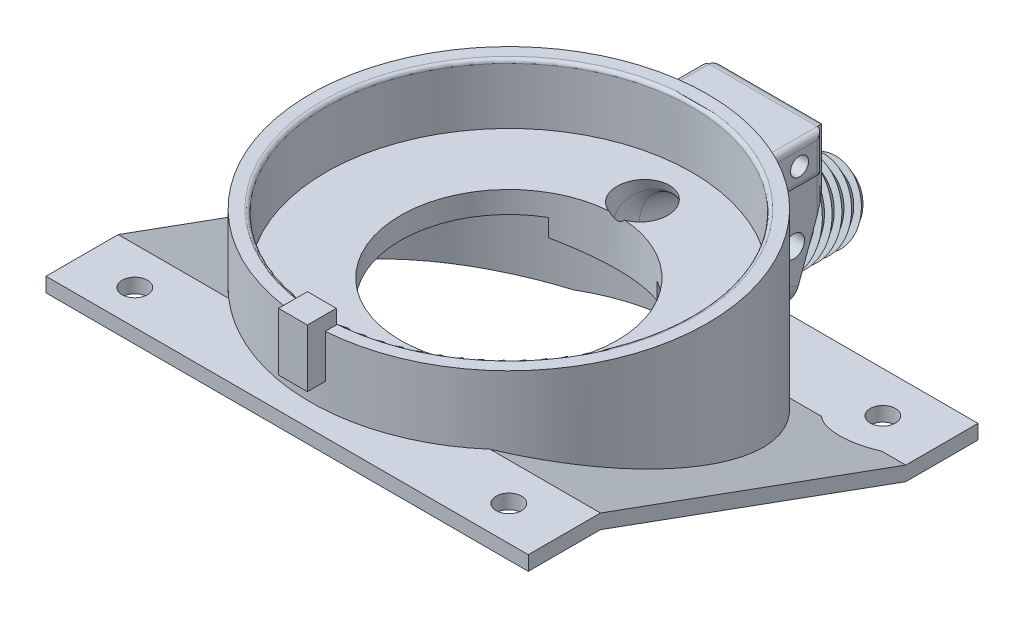
from build123d import *

# Parameters (mm, degrees)
SKETCH1_W                 = 56.8
SKETCH1_H                 = 56.8
BOSS_EXTRUDE1_DEPTH       = 5
SKETCH1_4_R               = 19.175
CUT_EXTRUDE1_DEPTH        = 1.65
SKETCH3_R                 = 15
CUT_EXTRUDE2_DEPTH        = 3.35
BOSS_EXTRUDE2_START       = 25.04
SKETCH3_3_R               = 27.5
SKETCH3_3_R_2             = 15
BOSS_EXTRUDE2_DEPTH       = 25.04
BOSS_EXTRUDE3_START       = 8.3
SKETCH4_R                 = 27.5
SKETCH4_R_2               = 25.35
BOSS_EXTRUDE3_DEPTH       = 8.3
BOSS_EXTRUDE9_DEPTH       = 1.5
BOSS_EXTRUDE9_DEPTH_BACK  = 2.5
SKETCH14_W                = 4
SKETCH14_H                = 8
FILLET3_R                 = 0.5
BOSS_EXTRUDE11_REACH      = 79.747
BOSS_EXTRUDE11_END_RADIUS = 27.5
SKETCH20_W                = 15
SKETCH20_H                = 15
FILLET6_R                 = 3
FILLET7_R                 = 3
SKETCH16_R                = 3.5
BOSS_EXTRUDE12_REACH      = 70.482
SKETCH31_W                = 15
SKETCH31_H                = 11.019981461
CUT_EXTRUDE3_REACH        = 84.891
CUT_EXTRUDE3_END_RADIUS   = 27.5
SKETCH33_W                = 15
SKETCH33_H                = 4
SKETCH29_R                = 1.5
SKETCH29_R_2              = 1.25
CUT_EXTRUDE4_DEPTH        = 74.003133429
FILLET8_R                 = 1.5
SKETCH35_W                = 18.713007332
SKETCH35_H                = 12.610559202
CUT_EXTRUDE5_DEPTH        = 10
SKETCH43_W                = 21.654052674
SKETCH43_H                = 15.753045928
CUT_EXTRUDE6_DEPTH        = 1.4
SKETCH44_W                = 56.8
SKETCH44_H                = 56.8
CUT_EXTRUDE8_DEPTH        = 13.5
BOSS_EXTRUDE14_DEPTH      = 66.8
BOSS_EXTRUDE15_REACH      = 56.298
SKETCH48_W                = 9
SKETCH48_H                = 4.737692211
SKETCH50_W                = 66.8
SKETCH50_H                = 45
CUT_EXTRUDE9_DEPTH        = 66.8
SKETCH51_W                = 66.8
SKETCH51_H                = 10
CUT_EXTRUDE10_DEPTH       = 66.8
SKETCH52_R                = 15
CUT_EXTRUDE11_DEPTH       = 66.8
CUT_EXTRUDE12_DEPTH       = 15.54
CUT_EXTRUDE13_DEPTH       = 70.889562662
CUT_EXTRUDE13_DEPTH_BACK  = 70.889562662
SKETCH54_R                = 1.75
SKETCH55_R                = 6
CUT_EXTRUDE14_DEPTH       = 10
SKETCH56_W                = 8.754083382
SKETCH56_H                = 5.505064768
BOSS_EXTRUDE16_DEPTH      = 0.8
SKETCH57_W                = 8.754083382
SKETCH57_H                = 5.505064768
BOSS_EXTRUDE17_DEPTH      = 0.8
CUT_EXTRUDE15_DEPTH       = 75.215099333
CUT_EXTRUDE15_DEPTH_BACK  = 75.215099333
SKETCH58_R                = 1.25
FILLET10_R                = 0.8
SKETCH59_R                = 25
CUT_EXTRUDE16_DEPTH       = 7.5
CUT_EXTRUDE17_DEPTH       = 15
BOSS_EXTRUDE18_REACH      = 73.887
BOSS_EXTRUDE18_END_RADIUS = 3.5
SKETCH64_R                = 1.5
SKETCH64_R_2              = 0.55
BOSS_EXTRUDE19_REACH      = 73.887
SKETCH65_R                = 1.5
SKETCH65_R_2              = 0.55
SKETCH67_R                = 3.5
CUT_EXTRUDE18_DEPTH       = 20


with BuildPart() as part:
    # Sketch1 → Boss-Extrude1 (new body)
    with BuildSketch(Plane(origin=(0, 0, 0), x_dir=(1, 0, 0), z_dir=(0, 1, 0))):
        Rectangle(SKETCH1_W, SKETCH1_H)
    extrude(amount=BOSS_EXTRUDE1_DEPTH)

    # Sketch1<4> → Cut-Extrude1 (cut)
    with BuildSketch(Plane(origin=(0, 0, 0), x_dir=(1, 0, 0), z_dir=(0, 1, 0))):
        with Locations(Location((0, 0, 0), (0, 0, 270))):
            Circle(SKETCH1_4_R)
    extrude(amount=CUT_EXTRUDE1_DEPTH, mode=Mode.SUBTRACT)

    # Sketch3 → Cut-Extrude2 (cut)
    with BuildSketch(Plane(origin=(0, 5, 0), x_dir=(1, 0, 0), z_dir=(0, 1, 0))):
        with Locations(Location((0, 0, 0), (0, 0, 270))):
            Circle(SKETCH3_R)
    extrude(amount=-CUT_EXTRUDE2_DEPTH, mode=Mode.SUBTRACT)

    # Sketch3<3> → Boss-Extrude2 (add)
    with BuildSketch(Plane(origin=(0, 5, 0), x_dir=(1, 0, 0), z_dir=(0, 1, 0)).offset(BOSS_EXTRUDE2_START)):
        with Locations(Location((0, 0, 0), (0, 0, 90))):
            Circle(SKETCH3_3_R)
        with Locations(Location((0, 0, 0), (0, 0, 270))):
            Circle(SKETCH3_3_R_2, mode=Mode.SUBTRACT)
    extrude(amount=-BOSS_EXTRUDE2_DEPTH)

    # Sketch4 → Boss-Extrude3 (add)
    with BuildSketch(Plane(origin=(0, 30.04, 0), x_dir=(1, 0, 0), z_dir=(0, 1, 0)).offset(BOSS_EXTRUDE3_START)):
        with Locations(Location((0, 0, 0), (0, 0, 90))):
            Circle(SKETCH4_R)
        with Locations(Location((0, 0, 0), (0, 0, 90))):
            Circle(SKETCH4_R_2, mode=Mode.SUBTRACT)
    extrude(amount=-BOSS_EXTRUDE3_DEPTH)

    # Sketch14 → Boss-Extrude9 (add, two sides: drawn at the far end of the back side and taken through both)
    with BuildSketch(Plane.XY.offset(28.4).offset(-BOSS_EXTRUDE9_DEPTH_BACK)):
        with Locations((0, 36.34)):
            Rectangle(SKETCH14_W, SKETCH14_H)
    extrude(amount=BOSS_EXTRUDE9_DEPTH + BOSS_EXTRUDE9_DEPTH_BACK)

    # Fillet3
    fillet3_edges = [part.edges().sort_by_distance(p)[0] for p in [
        (0, 38.34, 25.35),
    ]]
    fillet(fillet3_edges, radius=FILLET3_R)

    # Boss-Extrude11: up to this cylinder (the profile starts outside it)
    boss_extrude11_end = Plane(origin=(0, 20.788229, 0), z_dir=(0, -1, 0)) * Cylinder(BOSS_EXTRUDE11_END_RADIUS, 215.494, mode=Mode.PRIVATE)
    # Sketch20 → Boss-Extrude11 (add, up to the surface)
    with BuildSketch(Plane(origin=(0, -8.542695165, -23.470862068), x_dir=(1, 0, 0), z_dir=(0, -0.34202014332567265, -0.939692620785907)), mode=Mode.PRIVATE) as boss_extrude11_sk1:
        with Locations((0, -31.213317572)):
            Rectangle(SKETCH20_W, SKETCH20_H)
    boss_extrude11_tool1 = extrude(boss_extrude11_sk1.sketch, amount=-BOSS_EXTRUDE11_REACH, mode=Mode.PRIVATE) - boss_extrude11_end
    add(boss_extrude11_tool1.solids().sort_by_distance((0, 20.788229, -34.146445))[0])

    # Fillet6
    fillet6_edges = [part.edges().sort_by_distance(p)[0] for p in [
        (-7.5, 14.672986299, -29.019403727),
    ]]
    fillet(fillet6_edges, radius=FILLET6_R)

    # Fillet7
    fillet7_edges = [part.edges().sort_by_distance(p)[0] for p in [
        (7.5, 14.672986299, -29.019403727),
    ]]
    fillet(fillet7_edges, radius=FILLET7_R)

    # Sketch26 → Revolve4 (revolve)
    with BuildSketch(Plane(origin=(0, 29.330924193, -10.67558335), x_dir=(-1, 0, 0), z_dir=(0, -0.939692620785907, 0.34202014332567265)), mode=Mode.PRIVATE) as revolve4_sk:
        Polygon((0, 24.977169714), (7.5, 24.977169714), (6, 26.977169714), (7, 26.977169714), (5.5, 28.977169714), (6.5, 28.977169714), (5, 30.977169714), (6, 30.977169714), (4.5, 32.977169714), (5.5, 32.977169714), (4, 34.977169714), (5, 34.977169714), (3.5, 36.977169714), (4.5, 36.977169714), (3, 38.977169714), (4, 38.977169714), (2.5, 40.977169714), (3.5, 40.977169714), (2, 42.977169714), (3, 42.977169714), (1.5, 44.977169714), (2.5, 44.977169714), (1, 46.977169714), (2, 46.977169714), (0.5, 48.977169714), (1.5, 48.977169714), (0, 50.977169714), align=None)
    revolve(revolve4_sk.sketch.rotate(Axis((0, 25.301255695, -21.747006554), (0, -0.34202014332567277, -0.939692620785907)), 270), axis=Axis((0, 25.301255695, -21.747006554), (0, -0.34202014332567277, -0.939692620785907)))

    # Cut-Sweep3: sweep along a path in Sketch15
    with BuildLine(Plane(origin=(0, 0, 0), x_dir=(0, 0, -1), z_dir=(1, 0, 0))) as cut_sweep3_path:
        Line((17.740868921, 32.130351748), (19.356316645, 27.691945605))
        ThreePointArc((19.356316645, 27.691945605), (20.286660003, 26.231599054), (21.747006554, 25.301255695))
        Line((21.747006554, 25.301255695), (58.776383407, 11.823664728))
    # Sketch16 → Cut-Sweep3 (sweep, cut)
    with BuildSketch(Plane(origin=(0, 32.130351748, -17.740868921), x_dir=(-1, 0, 0), z_dir=(0, -0.9396926207859093, -0.3420201433256665))):
        Circle(SKETCH16_R)
    sweep(path=cut_sweep3_path.line, mode=Mode.SUBTRACT)


with BuildPart() as cut_sweep3_piece_1:
    # of the separate pieces the step leaves, piece 1, a body of its own (cut_sweep3_pieces)
    add(part.part.solids().sort_by_distance((4.5, 15.360920541, -27.129319933))[0])

    # Boss-Extrude12: up to this face of the body (flat: up to its plane)
    boss_extrude12_end = Plane(cut_sweep3_piece_1.part.faces().sort_by_distance((0, 29.576878134, -31.928363452))[0])
    # Sketch31 → Boss-Extrude12 (add, up to the picked face)
    with BuildSketch(Plane(origin=(0, 38.34, 0), x_dir=(1, 0, 0), z_dir=(0, 1, 0)), mode=Mode.PRIVATE) as boss_extrude12_sk1:
        with Locations((0, 31.201605763)):
            Rectangle(SKETCH31_W, SKETCH31_H)
    boss_extrude12_tool1 = split(extrude(boss_extrude12_sk1.sketch, amount=-BOSS_EXTRUDE12_REACH, mode=Mode.PRIVATE), bisect_by=boss_extrude12_end, keep=Keep.BOTH, mode=Mode.PRIVATE)
    add(boss_extrude12_tool1.solids().sort_by(Axis((0, 38.34, -31.201606), (0, -1, 0)))[0])

    # Cut-Extrude3: up to this cylinder (the profile starts outside it)
    cut_extrude3_end = Plane(origin=(0, 36.34, 0), z_dir=(0, -1, 0)) * Cylinder(CUT_EXTRUDE3_END_RADIUS, 225.782, mode=Mode.PRIVATE)
    # Sketch33 → Cut-Extrude3 (cut, up to the surface)
    with BuildSketch(Plane(origin=(0, 0, -36.711596493), x_dir=(-1, 0, 0), z_dir=(0, 0, -1)), mode=Mode.PRIVATE) as cut_extrude3_sk1:
        with Locations((0, 36.34)):
            Rectangle(SKETCH33_W, SKETCH33_H)
    cut_extrude3_tool1 = extrude(cut_extrude3_sk1.sketch, amount=-CUT_EXTRUDE3_REACH, mode=Mode.PRIVATE) - cut_extrude3_end
    add(cut_extrude3_tool1.solids().sort_by_distance((0, 36.34, -36.711596))[0], mode=Mode.SUBTRACT)

    # Sketch29 → Cut-Extrude4 (cut, through all)
    with BuildSketch(Plane.ZY.offset(7.5)):
        with Locations((-31.957513111, 21.584935232)):
            Circle(SKETCH29_R)
        with Locations((-31.957513111, 31.584935232)):
            Circle(SKETCH29_R_2)
    extrude(amount=-CUT_EXTRUDE4_DEPTH, mode=Mode.SUBTRACT)

    # Fillet8
    fillet8_edges = [cut_sweep3_piece_1.edges().sort_by_distance(p)[0] for p in [
        (7.5, 31.087961842, -36.711596493),
        (-7.5, 31.087961842, -36.711596493),
        (0, 34.34, -36.711596493),
    ]]
    fillet(fillet8_edges, radius=FILLET8_R)


with BuildPart() as cut_sweep3_piece_2:
    # of the separate pieces the step leaves, piece 2, a body of its own (cut_sweep3_pieces)
    add(part.part.solids().sort_by_distance((0, 12.455370514, -43.883666222))[0])


with BuildPart() as cut_sweep3_piece_3:
    # of the separate pieces the step leaves, piece 3, a body of its own (cut_sweep3_pieces)
    add(part.part.solids().sort_by_distance((0, 12.241176538, -45.934061536))[0])


with BuildPart() as cut_extrude5_tool:
    # Sketch35 → Cut-Extrude5 (new body)
    with BuildSketch(Plane(origin=(0, -12.954755014, -35.592896876), x_dir=(1, 0, 0), z_dir=(0, 0.3420201433256728, 0.939692620785907))):
        with Locations((0.331511876, 30.668843549)):
            Rectangle(SKETCH35_W, SKETCH35_H)
    extrude(amount=-CUT_EXTRUDE5_DEPTH)


with BuildPart() as cut_sweep3_piece_2_1:
    add(cut_sweep3_piece_2.part)

    # Cut-Extrude5: cut by cut_extrude5_tool
    add(cut_extrude5_tool.part, mode=Mode.SUBTRACT)


with BuildPart() as cut_sweep3_piece_3_1:
    add(cut_sweep3_piece_3.part)

    # Cut-Extrude5: cut by cut_extrude5_tool
    add(cut_extrude5_tool.part, mode=Mode.SUBTRACT)


with BuildPart() as cut_extrude6_tool:
    # Sketch43 → Cut-Extrude6 (new body)
    with BuildSketch(Plane(origin=(0, -12.954755014, -35.592896876), x_dir=(1, 0, 0), z_dir=(0, 0.3420201433256728, 0.939692620785907))):
        with Locations((-0.634232114, 31.877132413)):
            Rectangle(SKETCH43_W, SKETCH43_H)
    extrude(amount=CUT_EXTRUDE6_DEPTH)


with BuildPart() as cut_sweep3_piece_1_1:
    add(cut_sweep3_piece_1.part)

    # Cut-Extrude6: cut by cut_extrude6_tool
    add(cut_extrude6_tool.part, mode=Mode.SUBTRACT)

    # Sketch44 → Cut-Extrude8 (cut)
    with BuildSketch(Plane.XZ):
        Rectangle(SKETCH44_W, SKETCH44_H)
    extrude(amount=-CUT_EXTRUDE8_DEPTH, mode=Mode.SUBTRACT)

    # Sketch49 → Boss-Extrude14 (add)
    with BuildSketch(Plane(origin=(-33.4, 0, 0), x_dir=(0, 0, -1), z_dir=(1, 0, 0))):
        Polygon((31.581294343, 13.5), (21.581294343, 13.5), (-20.704873593, 28.89090645), (-30.704873593, 28.89090645), (-30.704873593, 26.89090645), (-20.704873593, 26.89090645), (21.581294343, 11.5), (31.581294343, 11.5), align=None)
    extrude(amount=BOSS_EXTRUDE14_DEPTH)

    # Boss-Extrude15: up to this plane
    boss_extrude15_end = Plane(origin=(33.4, 13.5, -31.581294343), z_dir=(0, -1, 0))
    # Sketch48 → Boss-Extrude15 (add, up to the surface)
    with BuildSketch(Plane(origin=(0, 22.283229537, -8.110432275), x_dir=(1, 0, 0), z_dir=(0, -0.939692620785907, 0.34202014332567265)), mode=Mode.PRIVATE) as boss_extrude15_sk1:
        with Locations((0, -22.608323609)):
            Rectangle(SKETCH48_W, SKETCH48_H)
    boss_extrude15_tool1 = split(extrude(boss_extrude15_sk1.sketch, amount=BOSS_EXTRUDE15_REACH, mode=Mode.PRIVATE), bisect_by=boss_extrude15_end, keep=Keep.BOTH, mode=Mode.PRIVATE)
    add(boss_extrude15_tool1.solids().sort_by_distance((0, 14.550727, -29.355307))[0])

    # Sketch50 → Cut-Extrude9 (cut)
    with BuildSketch(Plane(origin=(0, 17.09084985, -6.220560624), x_dir=(1, 0, 0), z_dir=(0, -0.939692620785907, 0.3420201433256727))):
        with Locations((0, 6.153448607)):
            Rectangle(SKETCH50_W, SKETCH50_H)
    extrude(amount=CUT_EXTRUDE9_DEPTH, mode=Mode.SUBTRACT)

    # Sketch51 → Cut-Extrude10 (cut)
    with BuildSketch(Plane.XZ.offset(-26.89090645)):
        with Locations((0, 25.704873593)):
            Rectangle(SKETCH51_W, SKETCH51_H)
    extrude(amount=CUT_EXTRUDE10_DEPTH, mode=Mode.SUBTRACT)

    # Sketch52 → Cut-Extrude11 (cut)
    with BuildSketch(Plane(origin=(0, 30.04, 0), x_dir=(1, 0, 0), z_dir=(0, 1, 0))):
        with Locations(Location((0, 0, 0), (0, 0, 270))):
            Circle(SKETCH52_R)
    extrude(amount=-CUT_EXTRUDE11_DEPTH, mode=Mode.SUBTRACT)

    # Sketch53 → Cut-Extrude12 (cut)
    with BuildSketch(Plane.XZ.offset(-11.5)):
        with BuildLine():
            Line((-7.5, -23.848480035), (-7.5, -7.844011354))
            Line((-7.5, -7.844011354), (7.5, -7.844011354))
            Line((7.5, -7.844011354), (7.5, -23.848480035))
            ThreePointArc((7.5, -23.848480035), (0, 25), (-7.5, -23.848480035))
        make_face()
    extrude(amount=-CUT_EXTRUDE12_DEPTH, mode=Mode.SUBTRACT)

    # Sketch54 → Cut-Extrude13 (cut, two sides: drawn at the far end of the back side and taken through both)
    with BuildSketch(Plane(origin=(0, 0, 0), x_dir=(1, 0, 0), z_dir=(0, 1, 0)).offset(-CUT_EXTRUDE13_DEPTH_BACK)):
        with Locations(Location((25.9, 25.9, 0), (0, 0, 90))):
            Circle(SKETCH54_R)
        with Locations(Location((25.9, -25.9, 0), (0, 0, 90))):
            Circle(SKETCH54_R)
        with Locations(Location((-25.9, -25.9, 0), (0, 0, 90))):
            Circle(SKETCH54_R)
        with Locations(Location((-25.9, 25.9, 0), (0, 0, 90))):
            Circle(SKETCH54_R)
    extrude(amount=CUT_EXTRUDE13_DEPTH + CUT_EXTRUDE13_DEPTH_BACK, mode=Mode.SUBTRACT)

    # Sketch55 → Cut-Extrude14 (cut)
    with BuildSketch(Plane(origin=(0, 13.5, 0), x_dir=(1, 0, 0), z_dir=(0, 1, 0))):
        with Locations((25.9, 25.9)):
            Circle(SKETCH55_R)
        with Locations((-25.9, 25.9)):
            Circle(SKETCH55_R)
    extrude(amount=CUT_EXTRUDE14_DEPTH, mode=Mode.SUBTRACT)

    # Sketch56 → Boss-Extrude16 (add)
    with BuildSketch(Plane.ZY.offset(7.5)):
        with Locations((-30.834554802, 31.587467616)):
            Rectangle(SKETCH56_W, SKETCH56_H)
    extrude(amount=BOSS_EXTRUDE16_DEPTH)

    # Sketch57 → Boss-Extrude17 (add)
    with BuildSketch(Plane(origin=(7.5, 0, 0), x_dir=(0, 0, -1), z_dir=(1, 0, 0))):
        with Locations((30.834554802, 31.587467616)):
            Rectangle(SKETCH57_W, SKETCH57_H)
    extrude(amount=BOSS_EXTRUDE17_DEPTH)

    # Sketch58 → Cut-Extrude15 (cut, two sides: drawn at the far end of the back side and taken through both)
    with BuildSketch(Plane(origin=(8.3, 0, 0), x_dir=(0, 0, -1), z_dir=(1, 0, 0)).offset(-CUT_EXTRUDE15_DEPTH_BACK)):
        with Locations(Location((31.957513111, 31.584935232, 0), (0, 0, 180))):
            Circle(SKETCH58_R)
    extrude(amount=CUT_EXTRUDE15_DEPTH + CUT_EXTRUDE15_DEPTH_BACK, mode=Mode.SUBTRACT)

    # Fillet10
    fillet10_edges = [cut_sweep3_piece_1_1.edges().sort_by_distance(p)[0] for p in [
        (8.3, 28.834935232, -30.834554802),
        (8.3, 31.587467616, -35.211596493),
        (8.3, 34.34, -30.834554802),
        (-8.3, 28.834935232, -30.834554802),
        (-8.3, 31.587467616, -35.211596493),
        (-8.3, 34.34, -30.834554802),
    ]]
    fillet(fillet10_edges, radius=FILLET10_R - 0.0001)  # a hair under: the kernel refuses the full size

    # Sketch59 → Cut-Extrude16 (cut)
    with BuildSketch(Plane(origin=(0, 11.5, 0), x_dir=(-1, 0, 0), z_dir=(0, -1, 0))):
        with Locations(Location((0, 0, 0), (0, 0, 72.542396876))):
            Circle(SKETCH59_R)
    extrude(amount=-CUT_EXTRUDE16_DEPTH, mode=Mode.SUBTRACT)

    # Sketch61 → Cut-Extrude17 (cut)
    with BuildSketch(Plane.ZY.offset(7.5)):
        Polygon((-23.848480035, 19), (-12.990381057, 24.59388566), (-12.990381057, 19), align=None)
    extrude(amount=-CUT_EXTRUDE17_DEPTH, mode=Mode.SUBTRACT)

    # Boss-Extrude18: up to this cylinder (the profile starts outside it)
    boss_extrude18_end = Plane(origin=(0, 21.116479987, -33.244583319), z_dir=(0, -0.34202014332567277, -0.939692620785907)) * Cylinder(BOSS_EXTRUDE18_END_RADIUS, 155.774, mode=Mode.PRIVATE)
    # Sketch64 → Boss-Extrude18 (add, up to the surface)
    with BuildSketch(Plane(origin=(4, 0, 0), x_dir=(0, 0, -1), z_dir=(1, 0, 0)), mode=Mode.PRIVATE) as boss_extrude18_sk1:
        with Locations(Location((31.957513111, 21.584935232, 0), (0, 0, 180))):
            Circle(SKETCH64_R)
        with Locations((31.957513111, 21.584935232)):
            Circle(SKETCH64_R_2, mode=Mode.SUBTRACT)
    boss_extrude18_tool1 = extrude(boss_extrude18_sk1.sketch, amount=-BOSS_EXTRUDE18_REACH, mode=Mode.PRIVATE) - boss_extrude18_end
    add(boss_extrude18_tool1.solids().sort_by_distance((4, 21.584935, -33.415087))[0])

    # Sketch65 → Boss-Extrude19 (add, up to next)
    with BuildSketch(Plane(origin=(-4, 0, 0), x_dir=(0, 0, -1), z_dir=(1, 0, 0)), mode=Mode.PRIVATE) as boss_extrude19_sk1:
        with Locations(Location((31.957513111, 21.584935232, 0), (0, 0, 180))):
            Circle(SKETCH65_R)
        with Locations((31.957513111, 21.584935232)):
            Circle(SKETCH65_R_2, mode=Mode.SUBTRACT)
    boss_extrude19_tool1 = extrude(boss_extrude19_sk1.sketch, amount=BOSS_EXTRUDE19_REACH, mode=Mode.PRIVATE) - cut_sweep3_piece_1_1.part
    add(boss_extrude19_tool1.solids().sort_by_distance((-4, 21.584935, -33.415087))[0])

    # Sketch67 → Cut-Extrude18 (cut)
    with BuildSketch(Plane(origin=(0, -12.475926814, -34.277327207), x_dir=(-1, 0, 0), z_dir=(0, -0.3420201433256726, -0.9396926207859071))):
        with Locations(Location((0, 31.213317572, 0), (0, 0, 270))):
            Circle(SKETCH67_R)
    extrude(amount=-CUT_EXTRUDE18_DEPTH, mode=Mode.SUBTRACT)


with BuildPart() as cut_sweep3_piece_2_2:
    add(cut_sweep3_piece_2_1.part)

    # Cut-Extrude6: cut by cut_extrude6_tool
    add(cut_extrude6_tool.part, mode=Mode.SUBTRACT)


solid = cut_sweep3_piece_1_1.part
